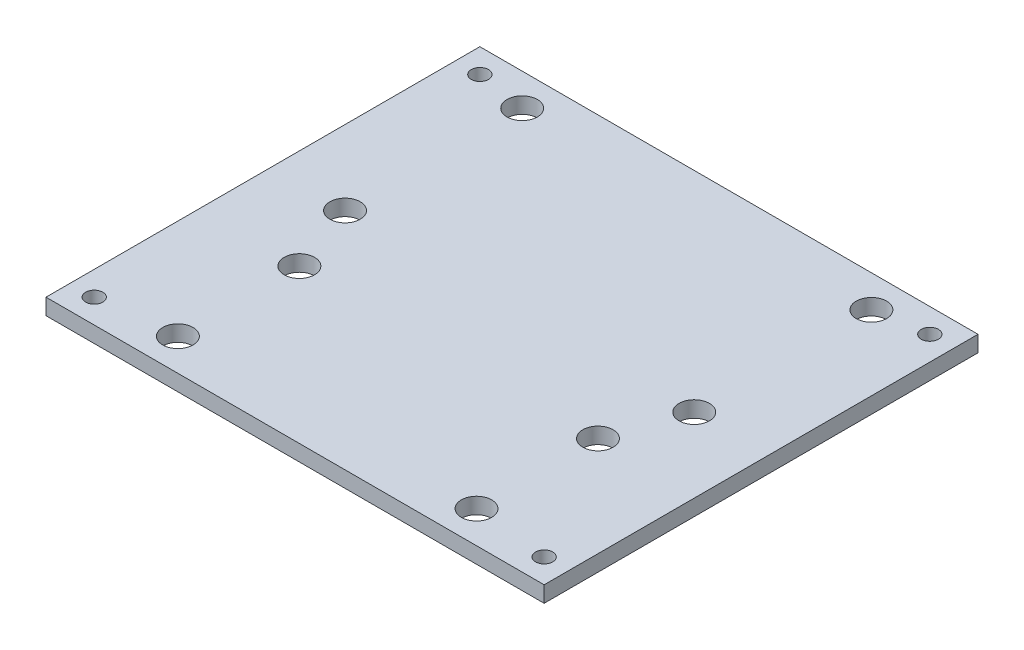
from build123d import *

# Parameters (mm, degrees)
SKETCH1_W            = 98.425
SKETCH1_H            = 85.725
BOSS_EXTRUDE1_DEPTH  = 3.175
M3_CLEARANCE_HOLE1_D = 3.4
SKETCH3_R            = 3
CUT_EXTRUDE1_DEPTH   = 66.338692117


with BuildPart() as part:
    # Sketch1 → Boss-Extrude1 (new body)
    with BuildSketch(Plane(origin=(0, 0, 0), x_dir=(1, 0, 0), z_dir=(0, 1, 0))):
        Rectangle(SKETCH1_W, SKETCH1_H)
    extrude(amount=BOSS_EXTRUDE1_DEPTH)

    # M3 Clearance Hole1 (through all)
    with Locations(Plane(origin=(-44.45, 0, 38.1), x_dir=(0, 0, -1), z_dir=(0, -1, 0))):
        with Locations((0, 0), (0, 88.9), (76.2, 0), (76.2, 88.9)):
            Hole(M3_CLEARANCE_HOLE1_D / 2)

    # Sketch3 → Cut-Extrude1 (cut, through all)
    with BuildSketch(Plane(origin=(0, 3.175, 0), x_dir=(1, 0, 0), z_dir=(0, 1, 0))):
        with Locations((-34.5, 36.5125)):
            Circle(SKETCH3_R)
        with Locations((34.5, 36.5125)):
            Circle(SKETCH3_R)
        with Locations((34.5, 1.5125)):
            Circle(SKETCH3_R)
        with Locations((-34.5, 1.5125)):
            Circle(SKETCH3_R)
        with Locations((-29.5, -12.5125)):
            Circle(SKETCH3_R)
        with Locations((-29.5, -36.5125)):
            Circle(SKETCH3_R)
        with Locations((29.5, -36.5125)):
            Circle(SKETCH3_R)
        with Locations((29.5, -12.5125)):
            Circle(SKETCH3_R)
    extrude(amount=-CUT_EXTRUDE1_DEPTH, mode=Mode.SUBTRACT)


solid = part.part
